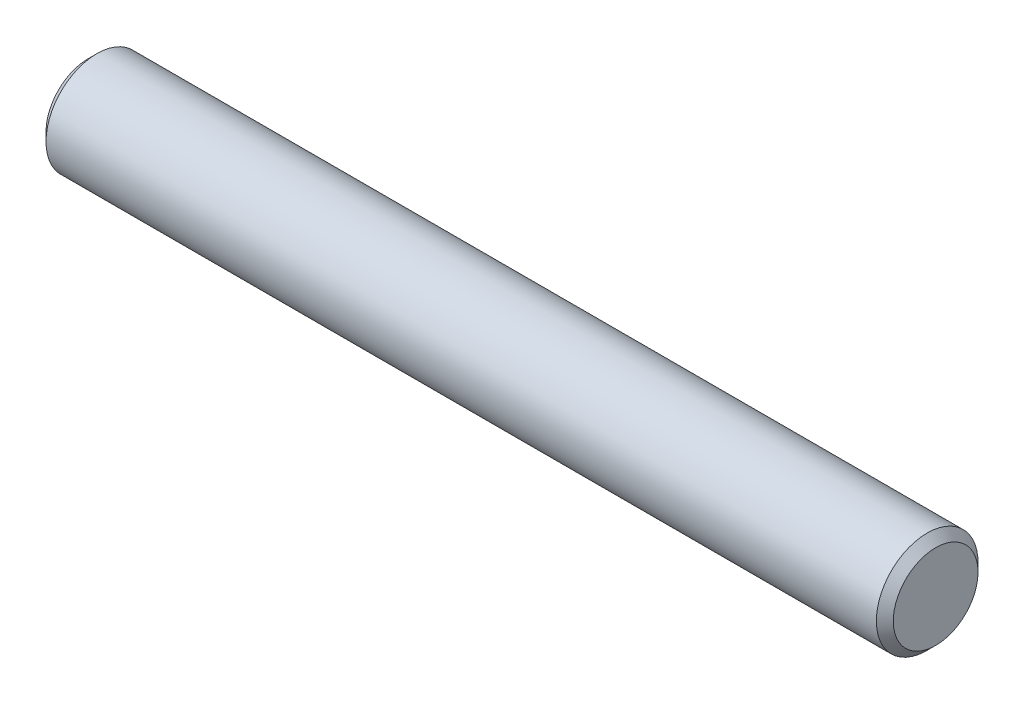
from build123d import *

# Parameters (mm, degrees)
SKETCH1_W     = 50
SKETCH1_H     = 3
CHAMFER1_SIZE = 0.5


with BuildPart() as part:
    # Sketch1 → Revolve1 (revolve)
    with BuildSketch(Plane.XY):
        with Locations((25, 1.5)):
            Rectangle(SKETCH1_W, SKETCH1_H)
    revolve(axis=Axis((50, 0, 0), (-1, 0, 0)))

    # Chamfer1
    chamfer1_edges = [part.edges().sort_by_distance(p)[0] for p in [
        (0, -3, 0),
        (50, -3, 0),
    ]]
    chamfer(chamfer1_edges, length=CHAMFER1_SIZE)


solid = part.part
